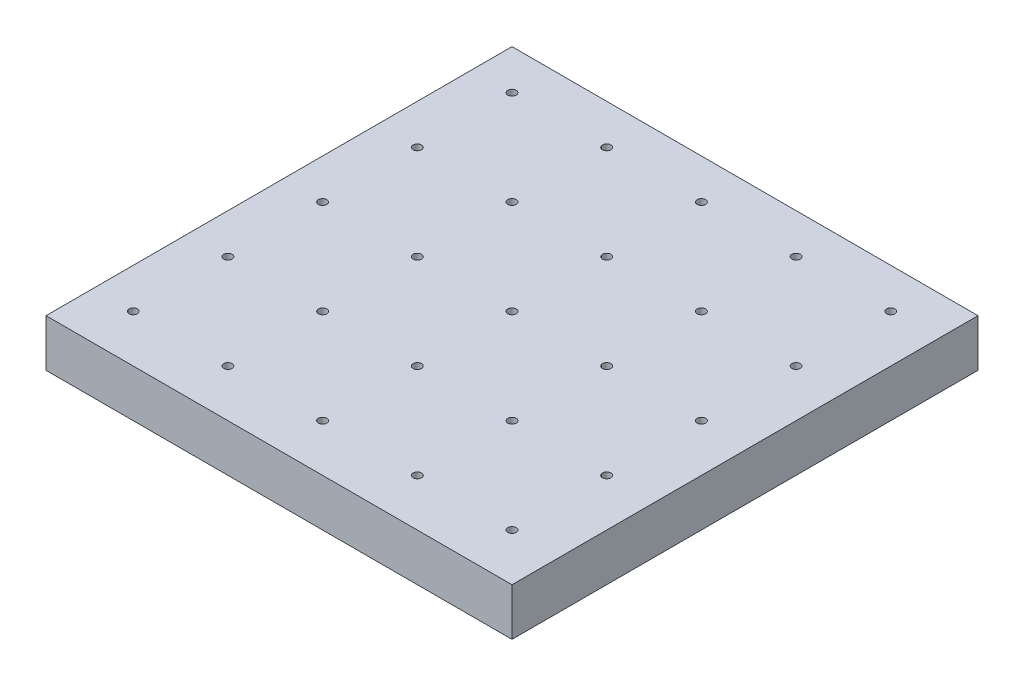
from build123d import *

# Parameters (mm, degrees)
SKETCH1_W             = 125
SKETCH1_H             = 125
BOSS_EXTRUDE1_DEPTH   = 12.7
F_4_40_TAPPED_HOLE1_D = 2.2606
LPATTERN1_COUNT       = 5
LPATTERN1_PITCH       = 25.4
LPATTERN1_COUNT_DIR2  = 5
LPATTERN1_PITCH_DIR2  = 25.4


with BuildPart() as part:
    # Sketch1 → Boss-Extrude1 (new body)
    with BuildSketch(Plane(origin=(0, 0, 0), x_dir=(1, 0, 0), z_dir=(0, 1, 0))):
        Rectangle(SKETCH1_W, SKETCH1_H)
    extrude(amount=BOSS_EXTRUDE1_DEPTH)

    # #4-40 Tapped Hole1 (through all)
    with Locations(Plane(origin=(49.8, 12.7, 49.8), x_dir=(0, 0, 1), z_dir=(0, 1, 0))):
        with Locations((0, 0)):
            f_4_40_tapped_hole1 = Hole(F_4_40_TAPPED_HOLE1_D / 2)

    # LPattern1: 4-40 Tapped Hole1 5 × 5
    with Locations(*[(-i * LPATTERN1_PITCH, 0, -j * LPATTERN1_PITCH_DIR2) for i in range(LPATTERN1_COUNT) for j in range(LPATTERN1_COUNT_DIR2) if (i, j) != (0, 0)]):
        add(f_4_40_tapped_hole1, mode=Mode.SUBTRACT)


solid = part.part
